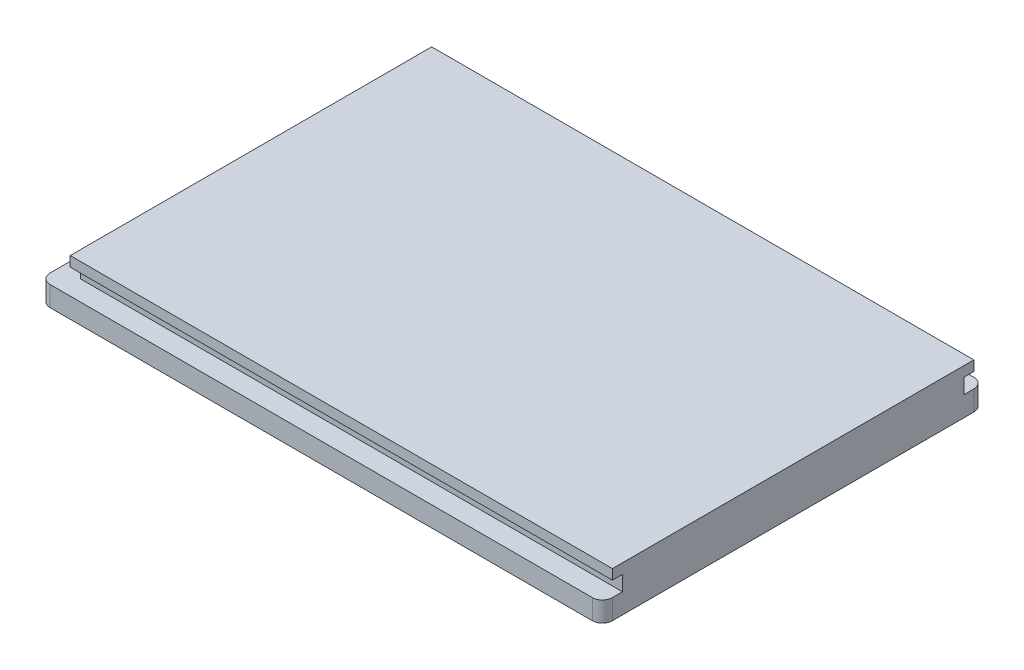
from build123d import *

# Parameters (mm, degrees)
SKETCH1_W           = 140
SKETCH1_H           = 95
BOSS_EXTRUDE1_DEPTH = 5
SKETCH2_W           = 135
SKETCH2_H           = 85
BOSS_EXTRUDE2_DEPTH = 3.75
SKETCH3_W           = 135
SKETCH3_H           = 90
BOSS_EXTRUDE3_DEPTH = 2.5
FILLET2_R           = 2.5


with BuildPart() as part:
    # Sketch1 → Boss-Extrude1 (new body)
    with BuildSketch(Plane(origin=(0, 0, 0), x_dir=(1, 0, 0), z_dir=(0, 1, 0))):
        with Locations((70, 47.5)):
            Rectangle(SKETCH1_W, SKETCH1_H)
    extrude(amount=BOSS_EXTRUDE1_DEPTH)

    # Sketch2 → Boss-Extrude2 (add)
    with BuildSketch(Plane(origin=(0, 5, 0), x_dir=(1, 0, 0), z_dir=(0, 1, 0))):
        with Locations((72.5, 47.5)):
            Rectangle(SKETCH2_W, SKETCH2_H)
    extrude(amount=BOSS_EXTRUDE2_DEPTH)

    # Sketch3 → Boss-Extrude3 (add)
    with BuildSketch(Plane(origin=(0, 8.75, 0), x_dir=(1, 0, 0), z_dir=(0, 1, 0))):
        with Locations((72.5, 47.5)):
            Rectangle(SKETCH3_W, SKETCH3_H)
    extrude(amount=BOSS_EXTRUDE3_DEPTH)

    # Fillet2
    fillet2_edges = [part.edges().sort_by_distance(p)[0] for p in [
        (140, 2.5, 0),
        (140, 2.5, -95),
        (0, 2.5, 0),
        (0, 2.5, -95),
    ]]
    fillet(fillet2_edges, radius=FILLET2_R)


solid = part.part
